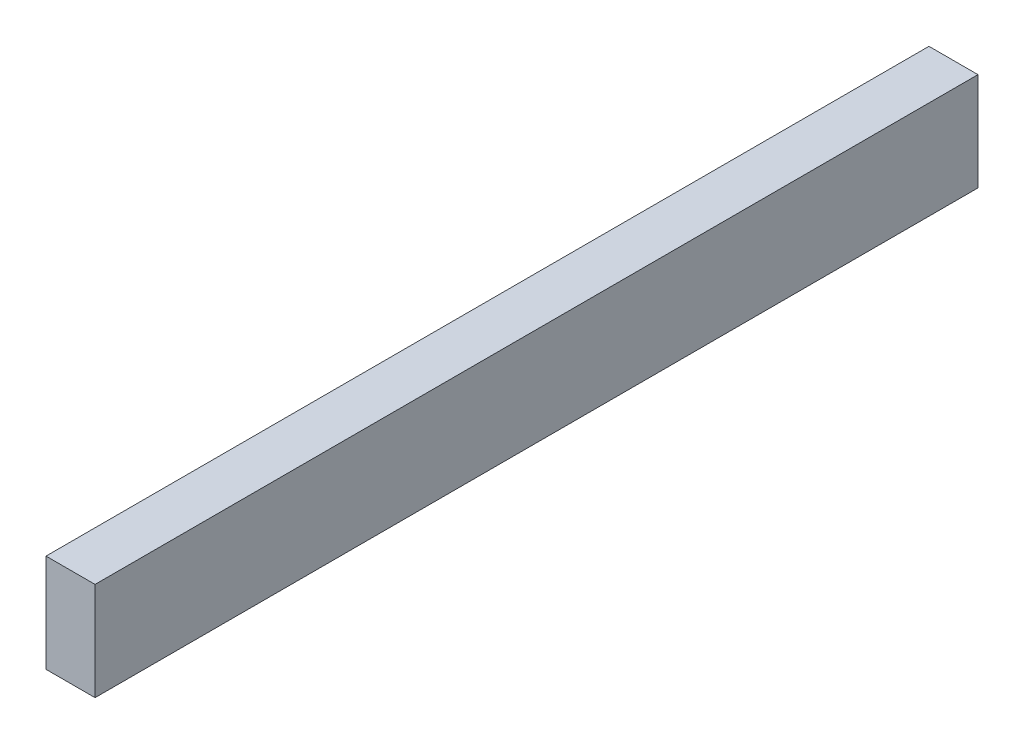
from build123d import *

# Parameters (mm, degrees)
SKETCH1_W           = 40
SKETCH1_H           = 80
BOSS_EXTRUDE1_DEPTH = 720


with BuildPart() as part:
    # Sketch1 → Boss-Extrude1 (new body)
    with BuildSketch(Plane.XY):
        with Locations((20, -40)):
            Rectangle(SKETCH1_W, SKETCH1_H)
    extrude(amount=BOSS_EXTRUDE1_DEPTH)


solid = part.part
